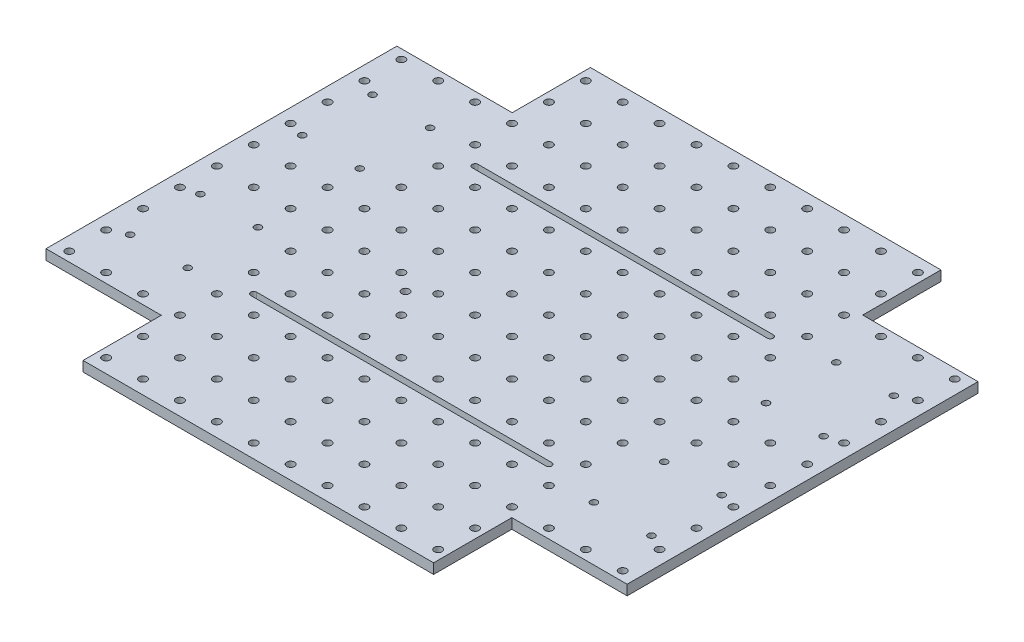
from build123d import *

# Parameters (mm, degrees)
BOSS_EXTRUDE1_DEPTH             = 5.4864
SKETCH2_R                       = 2.1
CUT_EXTRUDE1_DEPTH              = 210.1473179
F_3_0MM_CLEARANCE_DOWEL_HOLE1_D = 3.7
SKETCH5_R                       = 2.1
CUT_EXTRUDE2_DEPTH              = 210.1473179
CUT_EXTRUDE3_DEPTH              = 210.1473179


with BuildPart() as part:
    # Sketch1 → Boss-Extrude1 (new body)
    with BuildSketch(Plane(origin=(0, 0, 0), x_dir=(1, 0, 0), z_dir=(0, 1, 0))):
        Polygon((95, -95.1), (157.5, -95.1), (157.5, 95.1), (95, 95.1), (95, 137.5), (-95, 137.5), (-95, 95.1), (-157.5, 95.1), (-157.5, -95.1), (-95, -95.1), (-95, -137.5), (95, -137.5), align=None)
    extrude(amount=BOSS_EXTRUDE1_DEPTH)

    # Sketch2 → Cut-Extrude1 (cut, through all)
    with BuildSketch(Plane(origin=(0, 5.4864, 0), x_dir=(1, 0, 0), z_dir=(0, 1, 0))):
        with Locations((90, -130)):
            Circle(SKETCH2_R)
        with Locations((70, -130)):
            Circle(SKETCH2_R)
        with Locations((50, -130)):
            Circle(SKETCH2_R)
        with Locations((30, -130)):
            Circle(SKETCH2_R)
        with Locations((10, -130)):
            Circle(SKETCH2_R)
        with Locations((-10, -130)):
            Circle(SKETCH2_R)
        with Locations((-30, -130)):
            Circle(SKETCH2_R)
        with Locations((-50, -130)):
            Circle(SKETCH2_R)
        with Locations((-70, -130)):
            Circle(SKETCH2_R)
        with Locations((-90, -130)):
            Circle(SKETCH2_R)
        with Locations((-110, -130)):
            Circle(SKETCH2_R)
        with Locations((90, -110)):
            Circle(SKETCH2_R)
        with Locations((70, -110)):
            Circle(SKETCH2_R)
        with Locations((50, -110)):
            Circle(SKETCH2_R)
        with Locations((30, -110)):
            Circle(SKETCH2_R)
        with Locations((10, -110)):
            Circle(SKETCH2_R)
        with Locations((-10, -110)):
            Circle(SKETCH2_R)
        with Locations((-30, -110)):
            Circle(SKETCH2_R)
        with Locations((-50, -110)):
            Circle(SKETCH2_R)
        with Locations((-70, -110)):
            Circle(SKETCH2_R)
        with Locations((-90, -110)):
            Circle(SKETCH2_R)
        with Locations((-110, -110)):
            Circle(SKETCH2_R)
        with Locations((150, -90)):
            Circle(SKETCH2_R)
        with Locations((130, -90)):
            Circle(SKETCH2_R)
        with Locations((110, -90)):
            Circle(SKETCH2_R)
        with Locations((90, -90)):
            Circle(SKETCH2_R)
        with Locations((70, -90)):
            Circle(SKETCH2_R)
        with Locations((50, -90)):
            Circle(SKETCH2_R)
        with Locations((30, -90)):
            Circle(SKETCH2_R)
        with Locations((10, -90)):
            Circle(SKETCH2_R)
        with Locations((-10, -90)):
            Circle(SKETCH2_R)
        with Locations((-30, -90)):
            Circle(SKETCH2_R)
        with Locations((-50, -90)):
            Circle(SKETCH2_R)
        with Locations((-70, -90)):
            Circle(SKETCH2_R)
        with Locations((-90, -90)):
            Circle(SKETCH2_R)
        with Locations((-110, -90)):
            Circle(SKETCH2_R)
        with Locations((-130, -90)):
            Circle(SKETCH2_R)
        with Locations((-150, -90)):
            Circle(SKETCH2_R)
        with Locations((150, -70)):
            Circle(SKETCH2_R)
        with Locations((90, -70)):
            Circle(SKETCH2_R)
        with Locations((70, -70)):
            Circle(SKETCH2_R)
        with Locations((50, -70)):
            Circle(SKETCH2_R)
        with Locations((30, -70)):
            Circle(SKETCH2_R)
        with Locations((10, -70)):
            Circle(SKETCH2_R)
        with Locations((-10, -70)):
            Circle(SKETCH2_R)
        with Locations((-30, -70)):
            Circle(SKETCH2_R)
        with Locations((-50, -70)):
            Circle(SKETCH2_R)
        with Locations((-70, -70)):
            Circle(SKETCH2_R)
        with Locations((-90, -70)):
            Circle(SKETCH2_R)
        with Locations((-150, -70)):
            Circle(SKETCH2_R)
        with Locations((150, -50)):
            Circle(SKETCH2_R)
        with Locations((90, -50)):
            Circle(SKETCH2_R)
        with Locations((70, -50)):
            Circle(SKETCH2_R)
        with Locations((50, -50)):
            Circle(SKETCH2_R)
        with Locations((30, -50)):
            Circle(SKETCH2_R)
        with Locations((10, -50)):
            Circle(SKETCH2_R)
        with Locations((-10, -50)):
            Circle(SKETCH2_R)
        with Locations((-30, -50)):
            Circle(SKETCH2_R)
        with Locations((-50, -50)):
            Circle(SKETCH2_R)
        with Locations((-70, -50)):
            Circle(SKETCH2_R)
        with Locations((-90, -50)):
            Circle(SKETCH2_R)
        with Locations((-150, -50)):
            Circle(SKETCH2_R)
        with Locations((150, -30)):
            Circle(SKETCH2_R)
        with Locations((90, -30)):
            Circle(SKETCH2_R)
        with Locations((70, -30)):
            Circle(SKETCH2_R)
        with Locations((50, -30)):
            Circle(SKETCH2_R)
        with Locations((30, -30)):
            Circle(SKETCH2_R)
        with Locations((10, -30)):
            Circle(SKETCH2_R)
        with Locations((-10, -30)):
            Circle(SKETCH2_R)
        with Locations((-30, -30)):
            Circle(SKETCH2_R)
        with Locations((-50, -30)):
            Circle(SKETCH2_R)
        with Locations((-70, -30)):
            Circle(SKETCH2_R)
        with Locations((-90, -30)):
            Circle(SKETCH2_R)
        with Locations((-150, -30)):
            Circle(SKETCH2_R)
        with Locations((150, -10)):
            Circle(SKETCH2_R)
        with Locations((130, -10)):
            Circle(SKETCH2_R)
        with Locations((110, -10)):
            Circle(SKETCH2_R)
        with Locations((90, -10)):
            Circle(SKETCH2_R)
        with Locations((70, -10)):
            Circle(SKETCH2_R)
        with Locations((50, -10)):
            Circle(SKETCH2_R)
        with Locations((30, -10)):
            Circle(SKETCH2_R)
        with Locations((10, -10)):
            Circle(SKETCH2_R)
        with Locations((-10, -10)):
            Circle(SKETCH2_R)
        with Locations((-30, -10)):
            Circle(SKETCH2_R)
        with Locations((-50, -10)):
            Circle(SKETCH2_R)
        with Locations((-70, -10)):
            Circle(SKETCH2_R)
        with Locations((-90, -10)):
            Circle(SKETCH2_R)
        with Locations((-110, -10)):
            Circle(SKETCH2_R)
        with Locations((-130, -10)):
            Circle(SKETCH2_R)
        with Locations((-150, -10)):
            Circle(SKETCH2_R)
        with Locations((150, 10)):
            Circle(SKETCH2_R)
        with Locations((130, 10)):
            Circle(SKETCH2_R)
        with Locations((110, 10)):
            Circle(SKETCH2_R)
        with Locations((90, 10)):
            Circle(SKETCH2_R)
        with Locations((70, 10)):
            Circle(SKETCH2_R)
        with Locations((50, 10)):
            Circle(SKETCH2_R)
        with Locations((30, 10)):
            Circle(SKETCH2_R)
        with Locations((10, 10)):
            Circle(SKETCH2_R)
        with Locations((-10, 10)):
            Circle(SKETCH2_R)
        with Locations((-30, 10)):
            Circle(SKETCH2_R)
        with Locations((-50, 10)):
            Circle(SKETCH2_R)
        with Locations((-70, 10)):
            Circle(SKETCH2_R)
        with Locations((-90, 10)):
            Circle(SKETCH2_R)
        with Locations((-110, 10)):
            Circle(SKETCH2_R)
        with Locations((-130, 10)):
            Circle(SKETCH2_R)
        with Locations((-150, 10)):
            Circle(SKETCH2_R)
        with Locations((150, 30)):
            Circle(SKETCH2_R)
        with Locations((90, 30)):
            Circle(SKETCH2_R)
        with Locations((70, 30)):
            Circle(SKETCH2_R)
        with Locations((50, 30)):
            Circle(SKETCH2_R)
        with Locations((30, 30)):
            Circle(SKETCH2_R)
        with Locations((10, 30)):
            Circle(SKETCH2_R)
        with Locations((-10, 30)):
            Circle(SKETCH2_R)
        with Locations((-30, 30)):
            Circle(SKETCH2_R)
        with Locations((-50, 30)):
            Circle(SKETCH2_R)
        with Locations((-70, 30)):
            Circle(SKETCH2_R)
        with Locations((-90, 30)):
            Circle(SKETCH2_R)
        with Locations((-150, 30)):
            Circle(SKETCH2_R)
        with Locations((150, 50)):
            Circle(SKETCH2_R)
        with Locations((90, 50)):
            Circle(SKETCH2_R)
        with Locations((70, 50)):
            Circle(SKETCH2_R)
        with Locations((50, 50)):
            Circle(SKETCH2_R)
        with Locations((30, 50)):
            Circle(SKETCH2_R)
        with Locations((10, 50)):
            Circle(SKETCH2_R)
        with Locations((-10, 50)):
            Circle(SKETCH2_R)
        with Locations((-30, 50)):
            Circle(SKETCH2_R)
        with Locations((-50, 50)):
            Circle(SKETCH2_R)
        with Locations((-70, 50)):
            Circle(SKETCH2_R)
        with Locations((-90, 50)):
            Circle(SKETCH2_R)
        with Locations((-150, 50)):
            Circle(SKETCH2_R)
        with Locations((150, 70)):
            Circle(SKETCH2_R)
        with Locations((90, 70)):
            Circle(SKETCH2_R)
        with Locations((70, 70)):
            Circle(SKETCH2_R)
        with Locations((50, 70)):
            Circle(SKETCH2_R)
        with Locations((30, 70)):
            Circle(SKETCH2_R)
        with Locations((10, 70)):
            Circle(SKETCH2_R)
        with Locations((-10, 70)):
            Circle(SKETCH2_R)
        with Locations((-30, 70)):
            Circle(SKETCH2_R)
        with Locations((-50, 70)):
            Circle(SKETCH2_R)
        with Locations((-70, 70)):
            Circle(SKETCH2_R)
        with Locations((-90, 70)):
            Circle(SKETCH2_R)
        with Locations((-150, 70)):
            Circle(SKETCH2_R)
        with Locations((150, 90)):
            Circle(SKETCH2_R)
        with Locations((130, 90)):
            Circle(SKETCH2_R)
        with Locations((110, 90)):
            Circle(SKETCH2_R)
        with Locations((90, 90)):
            Circle(SKETCH2_R)
        with Locations((70, 90)):
            Circle(SKETCH2_R)
        with Locations((50, 90)):
            Circle(SKETCH2_R)
        with Locations((30, 90)):
            Circle(SKETCH2_R)
        with Locations((10, 90)):
            Circle(SKETCH2_R)
        with Locations((-10, 90)):
            Circle(SKETCH2_R)
        with Locations((-30, 90)):
            Circle(SKETCH2_R)
        with Locations((-50, 90)):
            Circle(SKETCH2_R)
        with Locations((-70, 90)):
            Circle(SKETCH2_R)
        with Locations((-90, 90)):
            Circle(SKETCH2_R)
        with Locations((-110, 90)):
            Circle(SKETCH2_R)
        with Locations((-130, 90)):
            Circle(SKETCH2_R)
        with Locations((-150, 90)):
            Circle(SKETCH2_R)
        with Locations((150, 110)):
            Circle(SKETCH2_R)
        with Locations((130, 110)):
            Circle(SKETCH2_R)
        with Locations((110, 110)):
            Circle(SKETCH2_R)
        with Locations((90, 110)):
            Circle(SKETCH2_R)
        with Locations((70, 110)):
            Circle(SKETCH2_R)
        with Locations((50, 110)):
            Circle(SKETCH2_R)
        with Locations((30, 110)):
            Circle(SKETCH2_R)
        with Locations((10, 110)):
            Circle(SKETCH2_R)
        with Locations((-10, 110)):
            Circle(SKETCH2_R)
        with Locations((-30, 110)):
            Circle(SKETCH2_R)
        with Locations((-50, 110)):
            Circle(SKETCH2_R)
        with Locations((-70, 110)):
            Circle(SKETCH2_R)
        with Locations((-90, 110)):
            Circle(SKETCH2_R)
        with Locations((-110, 110)):
            Circle(SKETCH2_R)
        with Locations((-130, 110)):
            Circle(SKETCH2_R)
        with Locations((-150, 110)):
            Circle(SKETCH2_R)
        with Locations((110, 130)):
            Circle(SKETCH2_R)
        with Locations((90, 130)):
            Circle(SKETCH2_R)
        with Locations((70, 130)):
            Circle(SKETCH2_R)
        with Locations((50, 130)):
            Circle(SKETCH2_R)
        with Locations((30, 130)):
            Circle(SKETCH2_R)
        with Locations((10, 130)):
            Circle(SKETCH2_R)
        with Locations((-10, 130)):
            Circle(SKETCH2_R)
        with Locations((-30, 130)):
            Circle(SKETCH2_R)
        with Locations((-50, 130)):
            Circle(SKETCH2_R)
        with Locations((-70, 130)):
            Circle(SKETCH2_R)
        with Locations((-90, 130)):
            Circle(SKETCH2_R)
        with Locations((-110, 130)):
            Circle(SKETCH2_R)
        with Locations((90, 150)):
            Circle(SKETCH2_R)
        with Locations((70, 150)):
            Circle(SKETCH2_R)
        with Locations((50, 150)):
            Circle(SKETCH2_R)
        with Locations((30, 150)):
            Circle(SKETCH2_R)
        with Locations((10, 150)):
            Circle(SKETCH2_R)
        with Locations((-10, 150)):
            Circle(SKETCH2_R)
        with Locations((-30, 150)):
            Circle(SKETCH2_R)
        with Locations((-50, 150)):
            Circle(SKETCH2_R)
        with Locations((-70, 150)):
            Circle(SKETCH2_R)
        with Locations((-90, 150)):
            Circle(SKETCH2_R)
        with Locations((-110, 150)):
            Circle(SKETCH2_R)
    extrude(amount=-CUT_EXTRUDE1_DEPTH, mode=Mode.SUBTRACT)

    # Ø3.0mm Clearance Dowel Hole1 (through all)
    with Locations(Plane(origin=(-115.856739121, 5.4864, -238.740763972), x_dir=(1, 0, 0), z_dir=(0, 1, 0))):
        with Locations((-25.443260879, -173.040763972), (5.756739121, -173.040763972), (-25.443260879, -211.140763972), (5.756739121, -211.140763972), (225.956739121, -173.040763972), (257.156739121, -173.040763972), (225.956739121, -211.140763972), (257.156739121, -211.140763972), (225.956739121, -304.440763972), (225.956739121, -266.340763972), (257.156739121, -266.340763972), (257.156739121, -304.440763972), (-25.443260879, -266.340763972), (-25.443260879, -304.440763972), (5.756739121, -304.440763972), (5.756739121, -266.340763972)):
            Hole(F_3_0MM_CLEARANCE_DOWEL_HOLE1_D / 2)

    # Sketch5 → Cut-Extrude2 (cut, through all)
    with BuildSketch(Plane(origin=(0, 5.4864, 0), x_dir=(1, 0, 0), z_dir=(0, 1, 0))):
        with Locations((-40, -17.7)):
            Circle(SKETCH5_R)
    extrude(amount=-CUT_EXTRUDE2_DEPTH, mode=Mode.SUBTRACT)

    # Sketch6 → Cut-Extrude3 (cut, through all)
    with BuildSketch(Plane(origin=(0, 5.4864, 0), x_dir=(1, 0, 0), z_dir=(0, 1, 0))):
        with BuildLine():
            Line((-80, 61.6), (80, 61.6))
            ThreePointArc((80, 61.6), (81.6, 60), (80, 58.4))
            Line((80, 58.4), (-80, 58.4))
            ThreePointArc((-80, 58.4), (-81.6, 60), (-80, 61.6))
        make_face()
        with BuildLine():
            Line((-80, -58.4), (80, -58.4))
            ThreePointArc((80, -58.4), (81.6, -60), (80, -61.6))
            Line((80, -61.6), (-80, -61.6))
            ThreePointArc((-80, -61.6), (-81.6, -60), (-80, -58.4))
        make_face()
    extrude(amount=-CUT_EXTRUDE3_DEPTH, mode=Mode.SUBTRACT)


solid = part.part
